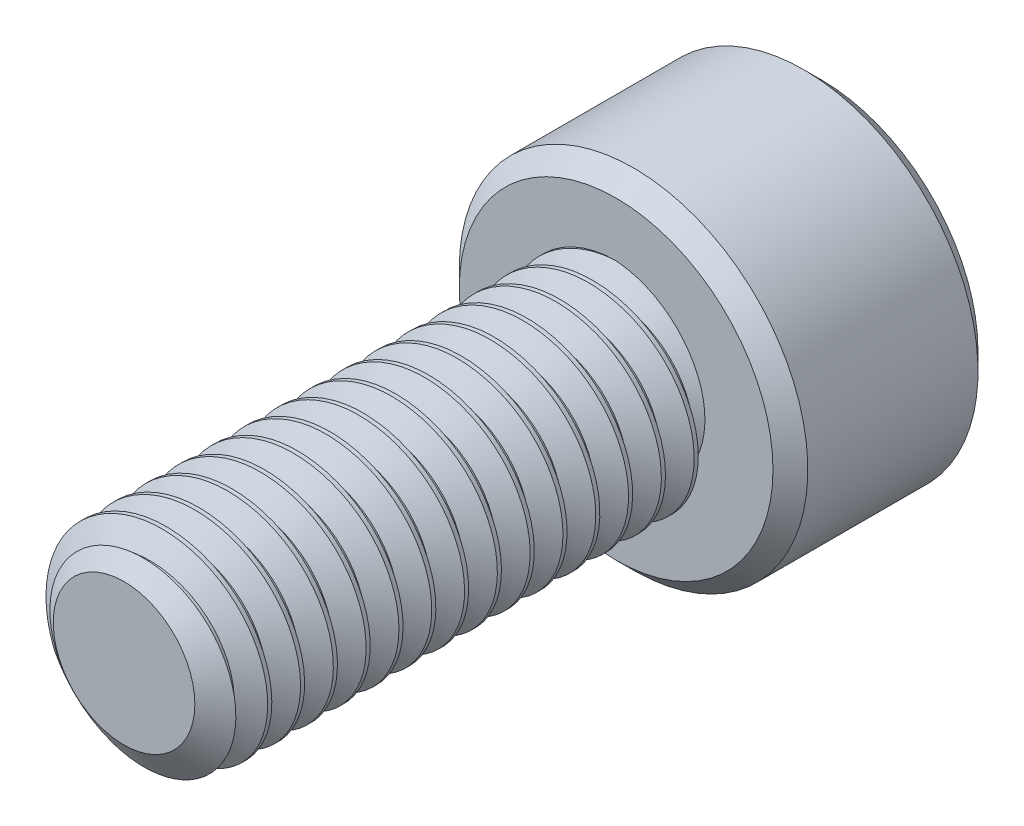
from build123d import *

# Parameters (mm, degrees)
SKETCH1_R          = 2.5
EXTRUDE1_DEPTH     = 12
CUT_SWEEP1_PITCH   = 0.8
SKETCH6_R          = 4.25
EXTRUDE2_DEPTH     = 5
CUT_EXTRUDE1_DEPTH = 3
CHAMFER1_SIZE      = 0.425


with BuildPart() as part:
    # Sketch1 → Extrude1 (new body)
    with BuildSketch(Plane.XY):
        Circle(SKETCH1_R)
    extrude(amount=-EXTRUDE1_DEPTH)

    # Cut-Sweep1: the profile of Sketch3 profile screwed along a right-hand helix of 16 turns, 6 arcs to a turn; built about Z, then put on its axis
    cut_sweep1_z = Axis((0, 0, 0), (0, 0, 1))
    cut_sweep1_corners = [(2.5003, 0, -0.700173205), (1.980384758, 0, -0.4), (1.980384758, 0, -0.3), (2.5003, 0, 0.000173205)]
    with BuildLine(mode=Mode.PRIVATE) as cut_sweep1_profile:
        Line(cut_sweep1_corners[0], cut_sweep1_corners[1])
        Line(cut_sweep1_corners[1], cut_sweep1_corners[2])
        Line(cut_sweep1_corners[2], cut_sweep1_corners[3])
        Line(cut_sweep1_corners[3], cut_sweep1_corners[0])
    cut_sweep1_cap = Face(cut_sweep1_profile.wire())
    cut_sweep1_turn_angles = [0, 30, 60, 90, 120, 150, 180, 210, 240, 270, 300, 330, 360]
    cut_sweep1_turn_weights = [1, 0.8660254037844387, 1, 0.8660254037844387, 1, 0.8660254037844387, 1, 0.8660254037844387, 1, 0.8660254037844387, 1, 0.8660254037844387, 1]
    cut_sweep1_turn_rails = [Edge.make_bspline([Vector(p[0], p[1], 0).rotate(cut_sweep1_z, cut_sweep1_turn_angles[k]) / cut_sweep1_turn_weights[k] + Vector(0, 0, p[2] + CUT_SWEEP1_PITCH * cut_sweep1_turn_angles[k] / 360) for k in range(13)], [0, 0, 0, 1, 1, 2, 2, 3, 3, 4, 4, 5, 5, 6, 6, 6], 2, cut_sweep1_turn_weights) for p in cut_sweep1_corners]
    cut_sweep1_turn_sides = [Face.make_surface_from_curves(cut_sweep1_turn_rails[p[0]], cut_sweep1_turn_rails[p[1]]) for p in [(0, 1), (1, 2), (2, 3), (3, 0)]]
    cut_sweep1 = Plane(origin=(0, 0, 0), x_dir=(0, 1, 0), z_dir=(0, 0, -1)) * Solid(Shell([*[p.moved(Location((0, 0, CUT_SWEEP1_PITCH * i))) for i in range(16) for p in cut_sweep1_turn_sides], cut_sweep1_cap, cut_sweep1_cap.rotate(cut_sweep1_z, 5760).moved(Location((0, 0, CUT_SWEEP1_PITCH * 5760 / 360)))]))
    add(cut_sweep1, mode=Mode.SUBTRACT)

    # Sketch4 → Cut-Revolve1 (revolve, cut)
    with BuildSketch(Plane(origin=(0, 0, 0), x_dir=(0, 0, -1), z_dir=(1, 0, 0)), mode=Mode.PRIVATE) as cut_revolve1_sk:
        Polygon((0.541691224, 2.5), (0, 1.726384758), (0, 2.5), align=None)
    revolve(cut_revolve1_sk.sketch.rotate(Axis((0, 0, 0), (0, 0, -1)), 260.43858876), axis=Axis((0, 0, 0), (0, 0, -1)), mode=Mode.SUBTRACT)

    # Sketch6 → Extrude2 (add)
    with BuildSketch(Plane(origin=(0, 0, -12), x_dir=(-1, 0, 0), z_dir=(0, 0, -1))):
        Circle(SKETCH6_R)
    extrude(amount=EXTRUDE2_DEPTH)

    # Sketch7 → Cut-Extrude1 (cut)
    with BuildSketch(Plane(origin=(0, 0, -17), x_dir=(-1, 0, 0), z_dir=(0, 0, -1))):
        Polygon((0, 2.309401077), (-2, 1.154700538), (-2, -1.154700538), (0, -2.309401077), (2, -1.154700538), (2, 1.154700538), align=None)
    extrude(amount=-CUT_EXTRUDE1_DEPTH, mode=Mode.SUBTRACT)

    # Cut-Extrude2 cone 1 section (through the dimple's axis) → Cut-Extrude2 (revolve, cut)
    with BuildSketch(Plane(origin=(0, 0, -17), x_dir=(0, 1, 0), z_dir=(1, 0, 0))):
        Polygon((0, 0), (2.309401077, 0), (0, 2.309401077), align=None)
    revolve(axis=Axis((0, 0, -17), (0, 0, 1)), mode=Mode.SUBTRACT)

    # Chamfer1
    chamfer1_edges = [part.edges().sort_by_distance(p)[0] for p in [
        (4.25, 0, -12),
        (4.25, 0, -17),
    ]]
    chamfer(chamfer1_edges, length=CHAMFER1_SIZE)


solid = part.part
